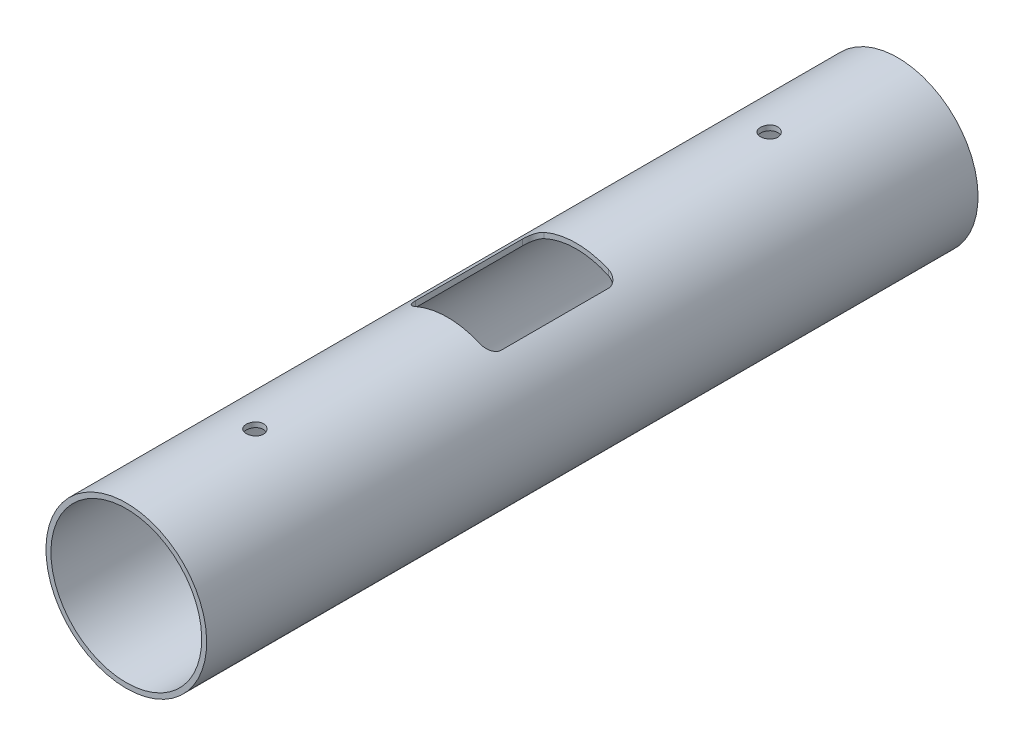
from build123d import *

# Parameters (mm, degrees)
SKETCH3_W               = 228.6
SKETCH3_H               = 1.4732
CUT_EXTRUDE1_DEPTH      = 120.15771193
CUT_EXTRUDE1_DEPTH_BACK = 120.15771193
SKETCH4_R               = 2.5527
CUT_EXTRUDE2_DEPTH      = 120.157712066


with BuildPart() as part:
    # Sketch3 → Revolve1 (revolve)
    with BuildSketch(Plane(origin=(0, 0, 0), x_dir=(0, 0, -1), z_dir=(1, 0, 0))):
        with Locations((0, 23.0759)):
            Rectangle(SKETCH3_W, SKETCH3_H)
    revolve(axis=Axis((0, 0, 114.3), (0, 0, -1)))

    # Sketch4 → Cut-Extrude1 (cut, two sides: drawn at the far end of the back side and taken through both)
    with BuildSketch(Plane(origin=(0, 0, 0), x_dir=(1, 0, 0), z_dir=(0, 1, 0)).offset(-CUT_EXTRUDE1_DEPTH_BACK)):
        with Locations((0, 76.2)):
            Circle(SKETCH4_R)
        with Locations((0, -76.2)):
            Circle(SKETCH4_R)
    extrude(amount=CUT_EXTRUDE1_DEPTH + CUT_EXTRUDE1_DEPTH_BACK, mode=Mode.SUBTRACT)

    # Sketch5 → Cut-Extrude2 (cut, through all)
    with BuildSketch(Plane(origin=(0, 0, 0), x_dir=(1, 0, 0), z_dir=(0, 1, 0))):
        with BuildLine():
            Line((9.525, -19.05), (-9.525, -19.05))
            ThreePointArc((-9.525, -19.05), (-11.77006403, -18.12006403), (-12.7, -15.875))
            Line((-12.7, -15.875), (-12.7, 15.875))
            ThreePointArc((-12.7, 15.875), (-11.77006403, 18.12006403), (-9.525, 19.05))
            Line((-9.525, 19.05), (9.525, 19.05))
            ThreePointArc((9.525, 19.05), (11.77006403, 18.12006403), (12.7, 15.875))
            Line((12.7, 15.875), (12.7, -15.875))
            ThreePointArc((12.7, -15.875), (11.77006403, -18.12006403), (9.525, -19.05))
        make_face()
    extrude(amount=CUT_EXTRUDE2_DEPTH, mode=Mode.SUBTRACT)


solid = part.part
